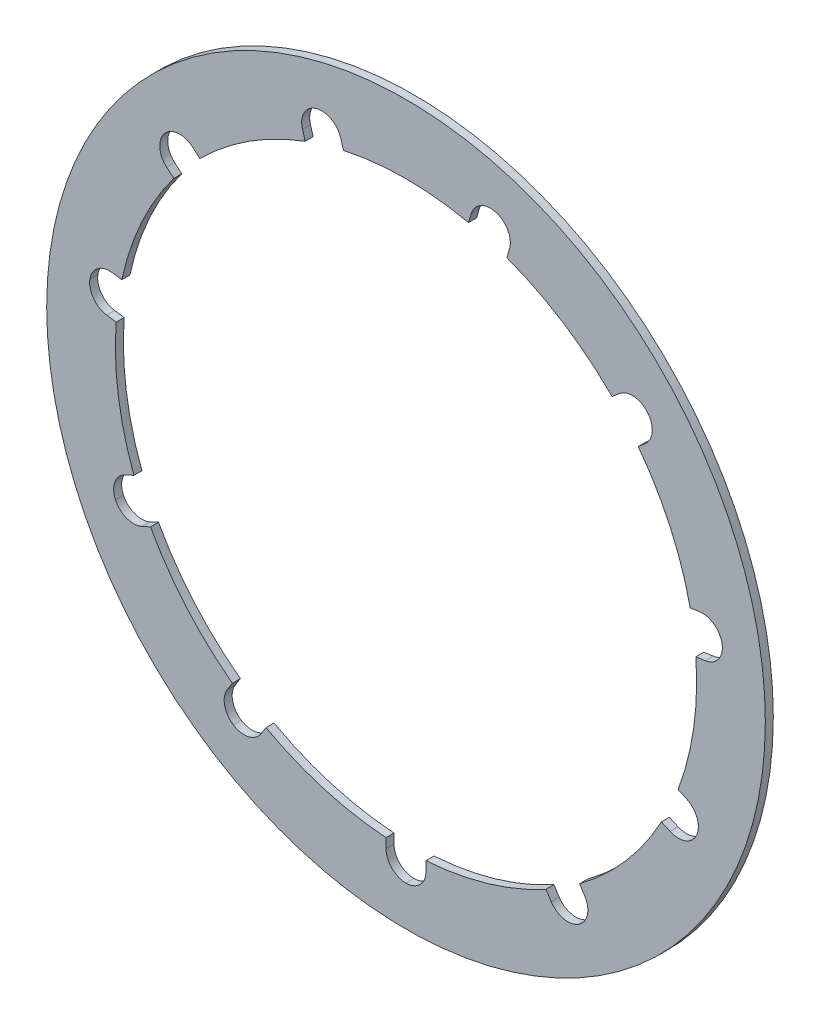
from build123d import *

# Parameters (mm, degrees)
BOSS_EXTRUDE1_DEPTH      = 0.3175
BOSS_EXTRUDE1_DEPTH_BACK = 0.3175
SKETCH1_R                = 28.575
SKETCH1_R_2              = 23.114
SKETCH4_W                = 3.175
SKETCH4_H                = 6.35
CUT_EXTRUDE2_DEPTH       = 41.416141268
FILLET1_R                = 1.5875
CIRPATTERN1_COUNT        = 11
FILLET1_OF_CIRPATTERN1_R = 1.5875


with BuildPart() as part:
    # Sketch1 → Boss-Extrude1 (new, two sides: drawn at the far end of the back side and taken through both)
    with BuildSketch(Plane.XY.offset(-BOSS_EXTRUDE1_DEPTH_BACK)):
        Circle(SKETCH1_R)
        Circle(SKETCH1_R_2, mode=Mode.SUBTRACT)
    extrude(amount=BOSS_EXTRUDE1_DEPTH + BOSS_EXTRUDE1_DEPTH_BACK)

    # Sketch4 → Cut-Extrude2 (cut, through all)
    with BuildSketch(Plane.XY.offset(0.3175)):
        with Locations((0, -22.225)):
            Rectangle(SKETCH4_W, SKETCH4_H)
    cut_extrude2 = extrude(amount=-CUT_EXTRUDE2_DEPTH, mode=Mode.SUBTRACT)

    # Fillet1
    fillet1_edges = [part.edges().sort_by_distance(p)[0] for p in [
        (1.5875, -25.4, 0),
        (-1.5875, -25.4, 0),
    ]]
    fillet(fillet1_edges, radius=FILLET1_R - 0.0001)  # a hair under: the kernel refuses the full size

    # CirPattern1: Cut-Extrude2 ×11 about axis
    cirpattern1_axis = Axis((0, 0, 0), (0, 0, 1))
    for i in range(1, CIRPATTERN1_COUNT):
        add(cut_extrude2.rotate(cirpattern1_axis, i * 360 / CIRPATTERN1_COUNT), mode=Mode.SUBTRACT)

    # Fillet1 of CirPattern1
    fillet1_of_cirpattern1_edges = [part.edges().sort_by_distance(p)[0] for p in [
        (15.067766747, -20.509572436, 0),
        (12.39678678, -22.226107032, 0),
        (23.764124015, -9.107500538, 0),
        (22.445181349, -11.995582123, 0),
        (24.915539818, 5.186138431, 0),
        (25.36738943, 2.043455353, 0),
        (18.156447773, 17.833215091, 0),
        (20.235630604, 15.433710193, 0),
        (5.632811848, 24.818371964, 0),
        (8.679202039, 23.923871096, 0),
        (-8.679202039, 23.923871096, 0),
        (-5.632811848, 24.818371964, 0),
        (-20.235630604, 15.433710193, 0),
        (-18.156447773, 17.833215091, 0),
        (-25.36738943, 2.043455353, 0),
        (-24.915539818, 5.186138431, 0),
        (-22.445181349, -11.995582123, 0),
        (-23.764124015, -9.107500538, 0),
        (-12.39678678, -22.226107032, 0),
        (-15.067766747, -20.509572436, 0),
    ]]
    fillet(fillet1_of_cirpattern1_edges, radius=FILLET1_OF_CIRPATTERN1_R - 0.0001)  # a hair under: the kernel refuses the full size


solid = part.part
